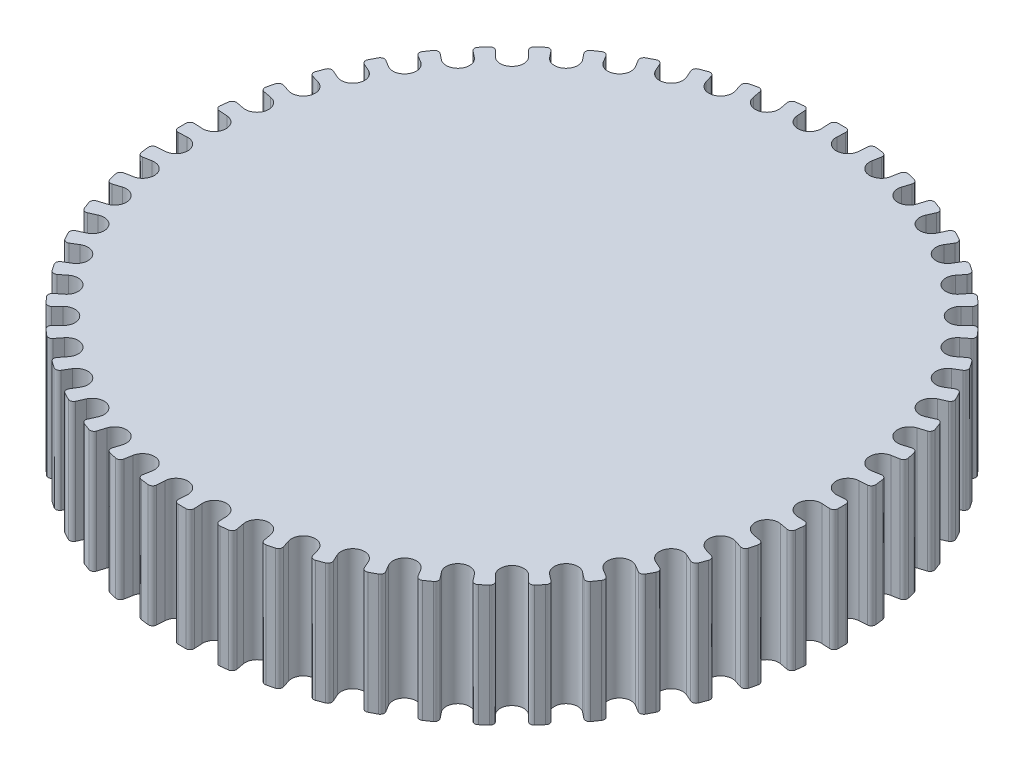
from build123d import *

# Parameters (mm, degrees)
SKETCH5_R                = 40.780285204
BOSS_EXTRUDE1_DEPTH      = 7.5
CUT_EXTRUDE1_DEPTH       = 59.157659191
FILLET1_R                = 0.5
CIRPATTERN1_COUNT        = 52
FILLET1_OF_CIRPATTERN1_R = 0.5


with BuildPart() as part:
    # Sketch5 → Boss-Extrude1 (new, symmetric)
    with BuildSketch(Plane(origin=(0, 0, 0), x_dir=(1, 0, 0), z_dir=(0, 1, 0))):
        Circle(SKETCH5_R)
    extrude(amount=BOSS_EXTRUDE1_DEPTH, both=True)

    # Sketch5<3> → Cut-Extrude1 (cut, symmetric)
    with BuildSketch(Plane(origin=(0, 0, 0), x_dir=(1, 0, 0), z_dir=(0, 1, 0))):
        with BuildLine():
            ThreePointArc((-1.013340839, 40.767693112), (-2.462252345, 40.705883785), (-3.908049946, 40.592595469))
            Line((-3.908049946, 40.592595469), (-3.816020228, 39.071162854))
            ThreePointArc((-3.816020228, 39.071162854), (-2.281116853, 37.711357122), (-0.92131112, 39.246260497))
            Line((-0.92131112, 39.246260497), (-1.013340839, 40.767693112))
        make_face()
    cut_extrude1 = extrude(amount=CUT_EXTRUDE1_DEPTH, both=True, mode=Mode.SUBTRACT)

    # Fillet1
    fillet1_edges = [part.edges().sort_by_distance(p)[0] for p in [
        (-3.908049946, 0, -40.592595469),
        (-1.013340839, 0, -40.767693112),
    ]]
    fillet(fillet1_edges, radius=FILLET1_R)

    # CirPattern1: Cut-Extrude1 ×52 about axis
    cirpattern1_axis = Axis((0, 36.971387876, 0), (0, -1, 0))
    for i in range(1, CIRPATTERN1_COUNT):
        add(cut_extrude1.rotate(cirpattern1_axis, i * 360 / CIRPATTERN1_COUNT), mode=Mode.SUBTRACT)

    # Fillet1 of CirPattern1
    fillet1_of_cirpattern1_edges = [part.edges().sort_by_distance(p)[0] for p in [
        (1.013340839, 0, -40.767693112),
        (3.908049946, 0, -40.592595469),
        (5.919954833, 0, -40.348305988),
        (8.772452563, 0, -39.825566378),
        (10.740242554, 0, -39.340549706),
        (13.508933067, 0, -38.47779085),
        (15.403913355, 0, -37.759119623),
        (18.048422908, 0, -36.568922487),
        (19.842960412, 0, -35.627076549),
        (22.324726101, 0, -34.126796888),
        (23.992652423, 0, -32.975510474),
        (26.275484517, 0, -31.187025743),
        (27.792477536, 0, -29.843087202),
        (29.843087202, 0, -27.792477536),
        (31.187025743, 0, -26.275484517),
        (32.975510474, 0, -23.992652423),
        (34.126796888, 0, -22.324726101),
        (35.627076549, 0, -19.842960412),
        (36.568922487, 0, -18.048422908),
        (37.759119623, 0, -15.403913355),
        (38.47779085, 0, -13.508933067),
        (39.340549706, 0, -10.740242554),
        (39.825566378, 0, -8.772452563),
        (40.348305988, 0, -5.919954833),
        (40.592595469, 0, -3.908049946),
        (40.767693112, 0, -1.013340839),
        (40.767693112, 0, 1.013340839),
        (40.592595469, 0, 3.908049946),
        (40.348305988, 0, 5.919954833),
        (39.825566378, 0, 8.772452563),
        (39.340549706, 0, 10.740242554),
        (38.47779085, 0, 13.508933067),
        (37.759119623, 0, 15.403913355),
        (36.568922487, 0, 18.048422908),
        (35.627076549, 0, 19.842960412),
        (34.126796888, 0, 22.324726101),
        (32.975510474, 0, 23.992652423),
        (31.187025743, 0, 26.275484517),
        (29.843087202, 0, 27.792477536),
        (27.792477536, 0, 29.843087202),
        (26.275484517, 0, 31.187025743),
        (23.992652423, 0, 32.975510474),
        (22.324726101, 0, 34.126796888),
        (19.842960412, 0, 35.627076549),
        (18.048422908, 0, 36.568922487),
        (15.403913355, 0, 37.759119623),
        (13.508933067, 0, 38.47779085),
        (10.740242554, 0, 39.340549706),
        (8.772452563, 0, 39.825566378),
        (5.919954833, 0, 40.348305988),
        (3.908049946, 0, 40.592595469),
        (1.013340839, 0, 40.767693112),
        (-1.013340839, 0, 40.767693112),
        (-3.908049946, 0, 40.592595469),
        (-5.919954833, 0, 40.348305988),
        (-8.772452563, 0, 39.825566378),
        (-10.740242554, 0, 39.340549706),
        (-13.508933067, 0, 38.47779085),
        (-15.403913355, 0, 37.759119623),
        (-18.048422908, 0, 36.568922487),
        (-19.842960412, 0, 35.627076549),
        (-22.324726101, 0, 34.126796888),
        (-23.992652423, 0, 32.975510474),
        (-26.275484517, 0, 31.187025743),
        (-27.792477536, 0, 29.843087202),
        (-29.843087202, 0, 27.792477536),
        (-31.187025743, 0, 26.275484517),
        (-32.975510474, 0, 23.992652423),
        (-34.126796888, 0, 22.324726101),
        (-35.627076549, 0, 19.842960412),
        (-36.568922487, 0, 18.048422908),
        (-37.759119623, 0, 15.403913355),
        (-38.47779085, 0, 13.508933067),
        (-39.340549706, 0, 10.740242554),
        (-39.825566378, 0, 8.772452563),
        (-40.348305988, 0, 5.919954833),
        (-40.592595469, 0, 3.908049946),
        (-40.767693112, 0, 1.013340839),
        (-40.767693112, 0, -1.013340839),
        (-40.592595469, 0, -3.908049946),
        (-40.348305988, 0, -5.919954833),
        (-39.825566378, 0, -8.772452563),
        (-39.340549706, 0, -10.740242554),
        (-38.47779085, 0, -13.508933067),
        (-37.759119623, 0, -15.403913355),
        (-36.568922487, 0, -18.048422908),
        (-35.627076549, 0, -19.842960412),
        (-34.126796888, 0, -22.324726101),
        (-32.975510474, 0, -23.992652423),
        (-31.187025743, 0, -26.275484517),
        (-29.843087202, 0, -27.792477536),
        (-27.792477536, 0, -29.843087202),
        (-26.275484517, 0, -31.187025743),
        (-23.992652423, 0, -32.975510474),
        (-22.324726101, 0, -34.126796888),
        (-19.842960412, 0, -35.627076549),
        (-18.048422908, 0, -36.568922487),
        (-15.403913355, 0, -37.759119623),
        (-13.508933067, 0, -38.47779085),
        (-10.740242554, 0, -39.340549706),
        (-8.772452563, 0, -39.825566378),
        (-5.919954833, 0, -40.348305988),
    ]]
    fillet(fillet1_of_cirpattern1_edges, radius=FILLET1_OF_CIRPATTERN1_R)


solid = part.part
